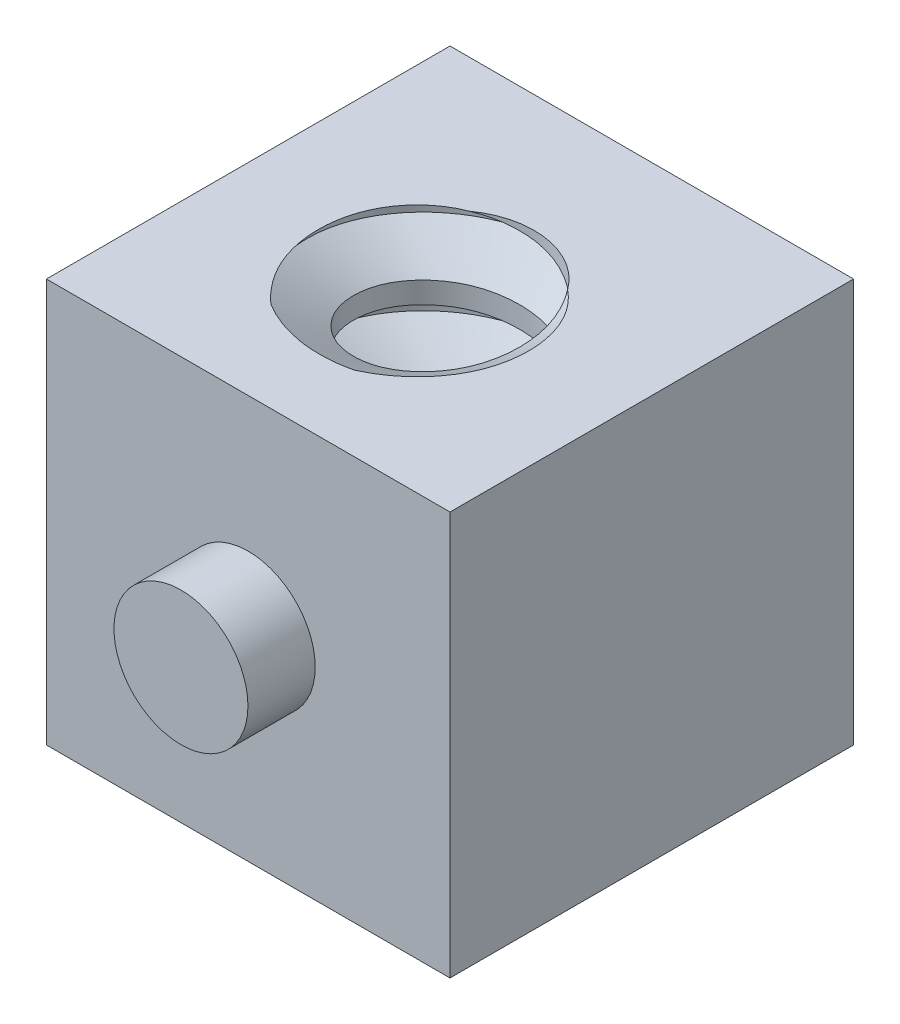
from build123d import *

# Parameters (mm, degrees)
SKETCH2_R               = 3.75
BOSS_EXTRUDE1_DEPTH     = 3.75
SKETCH3_R               = 1.245
BOSS_EXTRUDE3_DEPTH     = 1.25
CUT_EXTRUDE2_DEPTH      = 8.288689869
CUT_EXTRUDE2_DEPTH_BACK = 8.288689869
SKETCH4_R               = 1.565
SKETCH13_W              = 7.5
SKETCH13_H              = 7.5
BOSS_EXTRUDE4_DEPTH     = 7.5
CUT_EXTRUDE3_DEPTH      = 8.288689869
CUT_EXTRUDE3_DEPTH_BACK = 8.288689869
SKETCH4_3_R             = 1.565
THREAD2_PITCH           = 1.5875


with BuildPart() as part:
    # Sketch2 → Boss-Extrude1 (new, symmetric)
    with BuildSketch(Plane.XY):
        Circle(SKETCH2_R)
    extrude(amount=BOSS_EXTRUDE1_DEPTH, both=True)

    # Sketch3 → Boss-Extrude3 (add)
    with BuildSketch(Plane.XY.offset(3.75)):
        Circle(SKETCH3_R)
    boss_extrude3 = extrude(amount=BOSS_EXTRUDE3_DEPTH)

    # Mirror1: Boss-Extrude3 across plane
    add(boss_extrude3.mirror(Plane.XY))

    # Sketch4 → Cut-Extrude2 (cut, two sides: drawn at the far end of the back side and taken through both)
    with BuildSketch(Plane(origin=(0, 0, 0), x_dir=(1, 0, 0), z_dir=(0, 1, 0)).offset(-CUT_EXTRUDE2_DEPTH_BACK)):
        with Locations(Location((0, 0, 0), (0, 0, 270))):
            Circle(SKETCH4_R)
    extrude(amount=CUT_EXTRUDE2_DEPTH + CUT_EXTRUDE2_DEPTH_BACK, mode=Mode.SUBTRACT)

    # Sketch13 → Boss-Extrude4 (add)
    with BuildSketch(Plane(origin=(0, 0, -3.75), x_dir=(-1, 0, 0), z_dir=(0, 0, -1))):
        Rectangle(SKETCH13_W, SKETCH13_H)
    extrude(amount=-BOSS_EXTRUDE4_DEPTH)

    # Sketch4<3> → Cut-Extrude3 (cut, two sides: drawn at the far end of the back side and taken through both)
    with BuildSketch(Plane(origin=(0, 0, 0), x_dir=(1, 0, 0), z_dir=(0, 1, 0)).offset(-CUT_EXTRUDE3_DEPTH_BACK)):
        with Locations(Location((0, 0, 0), (0, 0, 270))):
            Circle(SKETCH4_3_R)
    extrude(amount=CUT_EXTRUDE3_DEPTH + CUT_EXTRUDE3_DEPTH_BACK, mode=Mode.SUBTRACT)

    # Thread2: the profile of Thread Profile3 profile screwed along a right-hand helix of 10.07874 turns, 8 arcs to a turn; built about Z, then put on its axis
    thread2_z = Axis((0, 0, 0), (0, 0, 1))
    thread2_corners = [(1.5647, 0, -0.000173205), (2.424259577, 0, 0.496093748), (2.424259577, 0, 0.694531248), (1.5647, 0, 1.190798201)]
    with BuildLine(mode=Mode.PRIVATE) as thread2_profile:
        Line(thread2_corners[0], thread2_corners[1])
        Line(thread2_corners[1], thread2_corners[2])
        Line(thread2_corners[2], thread2_corners[3])
        Line(thread2_corners[3], thread2_corners[0])
    thread2_cap = Face(thread2_profile.wire())
    thread2_turn_angles = [0, 22.5, 45, 67.5, 90, 112.5, 135, 157.5, 180, 202.5, 225, 247.5, 270, 292.5, 315, 337.5, 360]
    thread2_turn_weights = [1, 0.9238795325112867, 1, 0.9238795325112867, 1, 0.9238795325112867, 1, 0.9238795325112867, 1, 0.9238795325112867, 1, 0.9238795325112867, 1, 0.9238795325112867, 1, 0.9238795325112867, 1]
    thread2_turn_rails = [Edge.make_bspline([Vector(p[0], p[1], 0).rotate(thread2_z, thread2_turn_angles[k]) / thread2_turn_weights[k] + Vector(0, 0, p[2] + THREAD2_PITCH * thread2_turn_angles[k] / 360) for k in range(17)], [0, 0, 0, 1, 1, 2, 2, 3, 3, 4, 4, 5, 5, 6, 6, 7, 7, 8, 8, 8], 2, thread2_turn_weights) for p in thread2_corners]
    thread2_turn_sides = [Face.make_surface_from_curves(thread2_turn_rails[p[0]], thread2_turn_rails[p[1]]) for p in [(0, 1), (1, 2), (2, 3), (3, 0)]]
    thread2_last_angles = [3600, 3614.173228346, 3628.346456693]
    thread2_last_weights = [1, 0.9695598647982457, 1]
    thread2_last_rails = [Edge.make_bspline([Vector(p[0], p[1], 0).rotate(thread2_z, thread2_last_angles[k]) / thread2_last_weights[k] + Vector(0, 0, p[2] + THREAD2_PITCH * thread2_last_angles[k] / 360) for k in range(3)], [0, 0, 0, 1, 1, 1], 2, thread2_last_weights) for p in thread2_corners]
    thread2_last_sides = [Face.make_surface_from_curves(thread2_last_rails[p[0]], thread2_last_rails[p[1]]) for p in [(0, 1), (1, 2), (2, 3), (3, 0)]]
    thread2 = Plane(origin=(0, 8.75, 0), x_dir=(-1, 0, 0), z_dir=(0, -1, 0)) * Solid(Shell([*[p.moved(Location((0, 0, THREAD2_PITCH * i))) for i in range(10) for p in thread2_turn_sides], *thread2_last_sides, thread2_cap, thread2_cap.rotate(thread2_z, 3628.346456693).moved(Location((0, 0, THREAD2_PITCH * 3628.346456693 / 360)))]))
    add(thread2, mode=Mode.SUBTRACT)


solid = part.part
